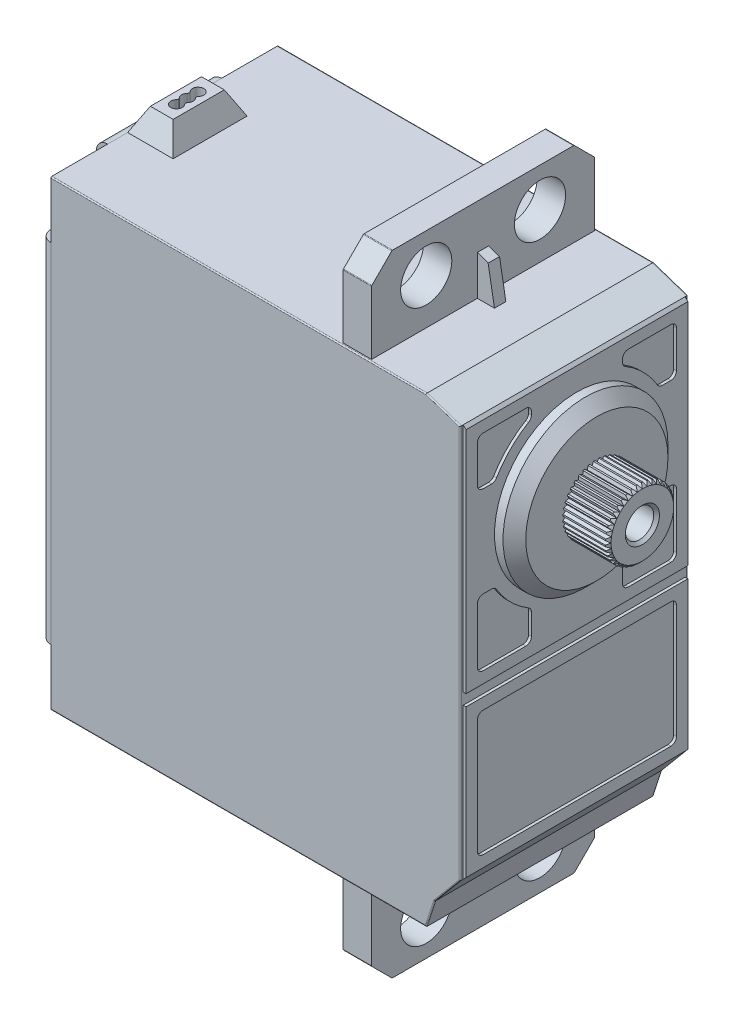
from build123d import *

# Parameters (mm, degrees)
BOSS_EXTRUDE1_DEPTH = 20
CUT_EXTRUDE1_REACH  = 65.246
SKETCH2_W           = 6.75
SKETCH2_H           = 2
CUT_EXTRUDE2_REACH  = 61.54
SKETCH3_R           = 2.25
SKETCH4_R           = 7.25
BOSS_EXTRUDE2_DEPTH = 2
SKETCH5_R           = 3
BOSS_EXTRUDE3_DEPTH = 4
SKETCH7_W           = 1
SKETCH7_H           = 3.5
BOSS_EXTRUDE4_DEPTH = 1.5
CUT_EXTRUDE4_REACH  = 69.476
CHAMFER1_SIZE       = 1
CHAMFER2_SIZE       = 2
CUT_EXTRUDE5_REACH  = 67.792
CUT_EXTRUDE6_REACH  = 68.843
CUT_EXTRUDE7_REACH  = 67.294
SKETCH12_R          = 1.25
CUT_EXTRUDE8_DEPTH  = 20
CHAMFER3_SIZE       = 0.25
SKETCH13_W          = 19.5
SKETCH13_H          = 13
SKETCH13_W_2        = 17.5
SKETCH13_H_2        = 11
SKETCH13_H_3        = 20.1
SKETCH13_R          = 7.25
BOSS_EXTRUDE5_DEPTH = 0.25
CHAMFER4_SIZE       = 0.25
SKETCH15_R          = 0.5
CUT_EXTRUDE10_DEPTH = 4
FILLET1_R           = 0.2
CUT_EXTRUDE11_START = -4
CUT_EXTRUDE11_DEPTH = 4
CIRPATTERN1_COUNT   = 40
SKETCH17_W          = 5
SKETCH17_H          = 5
CUT_EXTRUDE12_DEPTH = 1
FILLET2_R           = 2.5
SKETCH18_R          = 2
BOSS_EXTRUDE9_DEPTH = 1
CUT_EXTRUDE14_DEPTH = 0.9
FILLET3_R           = 0.25
FILLET4_R           = 0.4
FILLET5_SIZE        = 0.6
FILLET5_SIZE_2      = 0.4
FILLET7_R           = 0.2
SKETCH24_W          = 0.2
SKETCH24_H          = 7.4
CUT_EXTRUDE15_DEPTH = 2.5
FILLET8_R           = 0.1
FILLET9_R           = 0.5
FILLET10_R          = 1


with BuildPart() as part:
    # Sketch1 → Boss-Extrude1 (new body)
    with BuildSketch(Plane.XY):
        Polygon((5, 40.6), (26.5, 40.6), (26.5, 48), (29, 48), (29, 40.6), (37, 40.6), (37, 0), (29, 0), (29, -7.4), (26.5, -7.4), (26.5, 0), (0, 0), (0, 40.6), (1, 40.6), (1, 42.6), (5, 42.6), align=None)
    extrude(amount=BOSS_EXTRUDE1_DEPTH)

    # Sketch2 → Cut-Extrude1 (cut, up to next)
    with BuildSketch(Plane.ZY.offset(-1), mode=Mode.PRIVATE) as cut_extrude1_sk1:
        with Locations((16.625, 41.6)):
            Rectangle(SKETCH2_W, SKETCH2_H)
    cut_extrude1_tool1 = extrude(cut_extrude1_sk1.sketch, amount=-CUT_EXTRUDE1_REACH, mode=Mode.PRIVATE) & part.part
    # Sketch2 → Cut-Extrude1 (cut, up to next)
    with BuildSketch(Plane.ZY.offset(-1), mode=Mode.PRIVATE) as cut_extrude1_sk2:
        with Locations((3.375, 41.6)):
            Rectangle(SKETCH2_W, SKETCH2_H)
    cut_extrude1_tool2 = extrude(cut_extrude1_sk2.sketch, amount=-CUT_EXTRUDE1_REACH, mode=Mode.PRIVATE) & part.part
    add(cut_extrude1_tool1.solids().sort_by_distance((1, 41.6, 16.625))[0], mode=Mode.SUBTRACT)
    add(cut_extrude1_tool2.solids().sort_by_distance((1, 41.6, 3.375))[0], mode=Mode.SUBTRACT)

    # Sketch3 → Cut-Extrude2 (cut, up to next)
    with BuildSketch(Plane(origin=(29, 0, 0), x_dir=(0, 0, -1), z_dir=(1, 0, 0)), mode=Mode.PRIVATE) as cut_extrude2_sk1:
        with Locations((-15, -4)):
            Circle(SKETCH3_R)
    cut_extrude2_tool1 = extrude(cut_extrude2_sk1.sketch, amount=-CUT_EXTRUDE2_REACH, mode=Mode.PRIVATE) & part.part
    # Sketch3 → Cut-Extrude2 (cut, up to next)
    with BuildSketch(Plane(origin=(29, 0, 0), x_dir=(0, 0, -1), z_dir=(1, 0, 0)), mode=Mode.PRIVATE) as cut_extrude2_sk2:
        with Locations((-5, -4)):
            Circle(SKETCH3_R)
    cut_extrude2_tool2 = extrude(cut_extrude2_sk2.sketch, amount=-CUT_EXTRUDE2_REACH, mode=Mode.PRIVATE) & part.part
    # Sketch3 → Cut-Extrude2 (cut, up to next)
    with BuildSketch(Plane(origin=(29, 0, 0), x_dir=(0, 0, -1), z_dir=(1, 0, 0)), mode=Mode.PRIVATE) as cut_extrude2_sk3:
        with Locations((-15, 44.6)):
            Circle(SKETCH3_R)
    cut_extrude2_tool3 = extrude(cut_extrude2_sk3.sketch, amount=-CUT_EXTRUDE2_REACH, mode=Mode.PRIVATE) & part.part
    # Sketch3 → Cut-Extrude2 (cut, up to next)
    with BuildSketch(Plane(origin=(29, 0, 0), x_dir=(0, 0, -1), z_dir=(1, 0, 0)), mode=Mode.PRIVATE) as cut_extrude2_sk4:
        with Locations((-5, 44.6)):
            Circle(SKETCH3_R)
    cut_extrude2_tool4 = extrude(cut_extrude2_sk4.sketch, amount=-CUT_EXTRUDE2_REACH, mode=Mode.PRIVATE) & part.part
    add(cut_extrude2_tool1.solids().sort_by_distance((29, -4, 15))[0], mode=Mode.SUBTRACT)
    add(cut_extrude2_tool2.solids().sort_by_distance((29, -4, 5))[0], mode=Mode.SUBTRACT)
    add(cut_extrude2_tool3.solids().sort_by_distance((29, 44.6, 15))[0], mode=Mode.SUBTRACT)
    add(cut_extrude2_tool4.solids().sort_by_distance((29, 44.6, 5))[0], mode=Mode.SUBTRACT)

    # Sketch4 → Boss-Extrude2 (add)
    with BuildSketch(Plane(origin=(37, 0, 0), x_dir=(0, 0, -1), z_dir=(1, 0, 0))):
        with Locations((-10, 30.1)):
            Circle(SKETCH4_R)
    extrude(amount=BOSS_EXTRUDE2_DEPTH)

    # Sketch5 → Boss-Extrude3 (add)
    with BuildSketch(Plane(origin=(39, 0, 0), x_dir=(0, 0, -1), z_dir=(1, 0, 0))):
        with Locations((-10, 30.1)):
            Circle(SKETCH5_R)
    extrude(amount=BOSS_EXTRUDE3_DEPTH)

    # Sketch7 → Boss-Extrude4 (add)
    with BuildSketch(Plane(origin=(29, 0, 0), x_dir=(0, 0, -1), z_dir=(1, 0, 0))):
        with Locations((-10, 42.35)):
            Rectangle(SKETCH7_W, SKETCH7_H)
        with Locations((-10, -1.75)):
            Rectangle(SKETCH7_W, SKETCH7_H)
    extrude(amount=BOSS_EXTRUDE4_DEPTH)

    # Sketch8 → Cut-Extrude4 (cut, up to next)
    with BuildSketch(Plane.XY.offset(20), mode=Mode.PRIVATE) as cut_extrude4_sk1:
        Polygon((37, 0), (34, 0), (34.75, 2.318554417), (37, 5), align=None)
    cut_extrude4_tool1 = extrude(cut_extrude4_sk1.sketch, amount=-CUT_EXTRUDE4_REACH, mode=Mode.PRIVATE) & part.part
    # Sketch8 → Cut-Extrude4 (cut, up to next)
    with BuildSketch(Plane.XY.offset(20), mode=Mode.PRIVATE) as cut_extrude4_sk2:
        Polygon((37, 39.6), (34, 40.6), (37, 40.6), align=None)
    cut_extrude4_tool2 = extrude(cut_extrude4_sk2.sketch, amount=-CUT_EXTRUDE4_REACH, mode=Mode.PRIVATE) & part.part
    add(cut_extrude4_tool1.solids().sort_by_distance((35.86794, 1.802751, 20))[0], mode=Mode.SUBTRACT)
    add(cut_extrude4_tool2.solids().sort_by_distance((36, 40.266667, 20))[0], mode=Mode.SUBTRACT)

    # Chamfer1
    chamfer1_edges = [part.edges().sort_by_distance(p)[0] for p in [
        (39, 30.1, 17.25),
    ]]
    chamfer(chamfer1_edges, length=CHAMFER1_SIZE)

    # Chamfer2
    chamfer2_edges = [part.edges().sort_by_distance(p)[0] for p in [
        (27.75, -7.4, 20),
        (27.75, 48, 0),
        (27.75, -7.4, 0),
        (27.75, 48, 20),
    ]]
    chamfer(chamfer2_edges, length=CHAMFER2_SIZE)

    # Sketch9 → Cut-Extrude5 (cut, up to next)
    with BuildSketch(Plane(origin=(0, 0, 6.75), x_dir=(-1, 0, 0), z_dir=(0, 0, -1)), mode=Mode.PRIVATE) as cut_extrude5_sk1:
        Polygon((-5, 42.6), (-4, 42.6), (-5, 40.6), align=None)
    cut_extrude5_tool1 = extrude(cut_extrude5_sk1.sketch, amount=-CUT_EXTRUDE5_REACH, mode=Mode.PRIVATE) & part.part
    # Sketch9 → Cut-Extrude5 (cut, up to next)
    with BuildSketch(Plane(origin=(0, 0, 6.75), x_dir=(-1, 0, 0), z_dir=(0, 0, -1)), mode=Mode.PRIVATE) as cut_extrude5_sk2:
        Polygon((-1, 42.6), (-2, 42.6), (-1, 40.6), align=None)
    cut_extrude5_tool2 = extrude(cut_extrude5_sk2.sketch, amount=-CUT_EXTRUDE5_REACH, mode=Mode.PRIVATE) & part.part
    add(cut_extrude5_tool1.solids().sort_by_distance((4.666667, 41.933333, 6.75))[0], mode=Mode.SUBTRACT)
    add(cut_extrude5_tool2.solids().sort_by_distance((1.333333, 41.933333, 6.75))[0], mode=Mode.SUBTRACT)

    # Sketch10 → Cut-Extrude6 (cut, up to next)
    with BuildSketch(Plane.ZY.offset(-1), mode=Mode.PRIVATE) as cut_extrude6_sk1:
        Polygon((12.25, 42.6), (13.25, 40.6), (13.25, 42.6), align=None)
    cut_extrude6_tool1 = extrude(cut_extrude6_sk1.sketch, amount=-CUT_EXTRUDE6_REACH, mode=Mode.PRIVATE) & part.part
    # Sketch10 → Cut-Extrude6 (cut, up to next)
    with BuildSketch(Plane.ZY.offset(-1), mode=Mode.PRIVATE) as cut_extrude6_sk2:
        Polygon((6.75, 40.6), (7.75, 42.6), (6.75, 42.6), align=None)
    cut_extrude6_tool2 = extrude(cut_extrude6_sk2.sketch, amount=-CUT_EXTRUDE6_REACH, mode=Mode.PRIVATE) & part.part
    add(cut_extrude6_tool1.solids().sort_by_distance((1, 41.933333, 12.916667))[0], mode=Mode.SUBTRACT)
    add(cut_extrude6_tool2.solids().sort_by_distance((1, 41.933333, 7.083333))[0], mode=Mode.SUBTRACT)

    # Sketch11 → Cut-Extrude7 (cut, up to next)
    with BuildSketch(Plane(origin=(0, 0, 9.5), x_dir=(-1, 0, 0), z_dir=(0, 0, -1)), mode=Mode.PRIVATE) as cut_extrude7_sk1:
        Polygon((-29, -3.5), (-29.943400938, -3.156630139), (-30.5, 0), (-30.5, -3.5), align=None)
    cut_extrude7_tool1 = extrude(cut_extrude7_sk1.sketch, amount=-CUT_EXTRUDE7_REACH, mode=Mode.PRIVATE) & part.part
    # Sketch11 → Cut-Extrude7 (cut, up to next)
    with BuildSketch(Plane(origin=(0, 0, 9.5), x_dir=(-1, 0, 0), z_dir=(0, 0, -1)), mode=Mode.PRIVATE) as cut_extrude7_sk2:
        Polygon((-29, 44.1), (-29.943400938, 43.756630139), (-30.5, 40.6), (-30.5, 44.1), align=None)
    cut_extrude7_tool2 = extrude(cut_extrude7_sk2.sketch, amount=-CUT_EXTRUDE7_REACH, mode=Mode.PRIVATE) & part.part
    add(cut_extrude7_tool1.solids().sort_by_distance((30.209915, -2.462831, 9.5))[0], mode=Mode.SUBTRACT)
    add(cut_extrude7_tool2.solids().sort_by_distance((30.209915, 43.062831, 9.5))[0], mode=Mode.SUBTRACT)

    # Sketch12 → Cut-Extrude8 (cut)
    with BuildSketch(Plane(origin=(43, 0, 0), x_dir=(0, 0, -1), z_dir=(1, 0, 0))):
        with Locations((-10, 30.1)):
            Circle(SKETCH12_R)
    extrude(amount=-CUT_EXTRUDE8_DEPTH, mode=Mode.SUBTRACT)

    # Chamfer3
    chamfer3_edges = [part.edges().sort_by_distance(p)[0] for p in [
        (43, 30.1, 11.25),
        (43, 30.1, 13),
    ]]
    chamfer(chamfer3_edges, length=CHAMFER3_SIZE)

    # Sketch13 → Boss-Extrude5 (add)
    # profile 1 of 2: a face of its own
    with BuildSketch(Plane(origin=(37, 0, 0), x_dir=(0, 0, -1), z_dir=(1, 0, 0))):
        with Locations((-10, 11.75)):
            Rectangle(SKETCH13_W, SKETCH13_H)
        with Locations((-10, 11.75)):
            Rectangle(SKETCH13_W_2, SKETCH13_H_2, mode=Mode.SUBTRACT)
    # profile 2 of 2: a face of its own
    with BuildSketch(Plane(origin=(37, 0, 0), x_dir=(0, 0, -1), z_dir=(1, 0, 0))):
        with Locations((-10, 29.3)):
            Rectangle(SKETCH13_W, SKETCH13_H_3)
        with Locations((-10, 30.1)):
            Circle(SKETCH13_R, mode=Mode.SUBTRACT)
        with BuildLine():
            ThreePointArc((-14, 22.884565155), (-15.833630945, 24.266369055), (-17.215434845, 26.1))
            Line((-17.215434845, 26.1), (-18.75, 26.1))
            Line((-18.75, 26.1), (-18.75, 20.25))
            Line((-18.75, 20.25), (-14, 20.25))
            Line((-14, 20.25), (-14, 22.884565155))
        make_face(mode=Mode.SUBTRACT)
        with BuildLine():
            ThreePointArc((-2.784565155, 26.1), (-4.166369055, 24.266369055), (-6, 22.884565155))
            Line((-6, 22.884565155), (-6, 20.25))
            Line((-6, 20.25), (-1.25, 20.25))
            Line((-1.25, 20.25), (-1.25, 26.1))
            Line((-1.25, 26.1), (-2.784565155, 26.1))
        make_face(mode=Mode.SUBTRACT)
        with BuildLine():
            ThreePointArc((-6, 37.315434845), (-4.166369055, 35.933630945), (-2.784565155, 34.1))
            Line((-2.784565155, 34.1), (-1.25, 34.1))
            Line((-1.25, 34.1), (-1.25, 38.35))
            Line((-1.25, 38.35), (-6, 38.35))
            Line((-6, 38.35), (-6, 37.315434845))
        make_face(mode=Mode.SUBTRACT)
        with BuildLine():
            ThreePointArc((-17.215434845, 34.1), (-15.833630945, 35.933630945), (-14, 37.315434845))
            Line((-14, 37.315434845), (-14, 38.35))
            Line((-14, 38.35), (-18.75, 38.35))
            Line((-18.75, 38.35), (-18.75, 34.1))
            Line((-18.75, 34.1), (-17.215434845, 34.1))
        make_face(mode=Mode.SUBTRACT)
    extrude(amount=BOSS_EXTRUDE5_DEPTH)

    # Chamfer4
    chamfer4_edges = [part.edges().sort_by_distance(p)[0] for p in [
        (37, 5.25, 10),
        (37, 39.35, 10),
    ]]
    chamfer(chamfer4_edges, length=CHAMFER4_SIZE - 0.0001)  # a hair under: the kernel refuses the full size

    # Sketch15 → Cut-Extrude10 (cut)
    with BuildSketch(Plane(origin=(0, 42.6, 0), x_dir=(1, 0, 0), z_dir=(0, 1, 0))):
        with Locations((3, -10)):
            Circle(SKETCH15_R)
        with Locations((3, -9.05)):
            Circle(SKETCH15_R)
        with Locations((3, -10.95)):
            Circle(SKETCH15_R)
    extrude(amount=-CUT_EXTRUDE10_DEPTH, mode=Mode.SUBTRACT)

    # Fillet1
    fillet1_edges = [part.edges().sort_by_distance(p)[0] for p in [
        (2.84387505, 40.6, 9.525),
        (3.15612495, 40.6, 10.475),
        (2.84387505, 40.6, 10.475),
        (3.15612495, 40.6, 9.525),
    ]]
    fillet(fillet1_edges, radius=FILLET1_R)

    # Sketch16 → Cut-Extrude11 (cut)
    with BuildSketch(Plane(origin=(43, 0, 0), x_dir=(0, 0, -1), z_dir=(1, 0, 0)).offset(CUT_EXTRUDE11_START)):
        with BuildLine():
            Line((-12.75, 30.1), (-12.995087524, 30.271612132))
            ThreePointArc((-12.995087524, 30.271612132), (-13, 30.1), (-12.995087524, 29.928387868))
            Line((-12.995087524, 29.928387868), (-12.75, 30.1))
        make_face()
    cut_extrude11 = extrude(amount=CUT_EXTRUDE11_DEPTH, mode=Mode.SUBTRACT)

    # CirPattern1: Cut-Extrude11 ×40 about axis
    cirpattern1_axis = Axis((0, 30.1, 10), (1, 0, 0))
    for i in range(1, CIRPATTERN1_COUNT):
        add(cut_extrude11.rotate(cirpattern1_axis, i * 360 / CIRPATTERN1_COUNT), mode=Mode.SUBTRACT)

    # Sketch17 → Cut-Extrude12 (cut)
    with BuildSketch(Plane.ZY):
        with Locations((17.5, 2.5)):
            Rectangle(SKETCH17_W, SKETCH17_H)
        with Locations((2.5, 38.1)):
            Rectangle(SKETCH17_W, SKETCH17_H)
        with Locations((2.5, 2.5)):
            Rectangle(SKETCH17_W, SKETCH17_H)
        with Locations((17.5, 38.1)):
            Rectangle(SKETCH17_W, SKETCH17_H)
    extrude(amount=-CUT_EXTRUDE12_DEPTH, mode=Mode.SUBTRACT)

    # Fillet2
    fillet2_edges = [part.edges().sort_by_distance(p)[0] for p in [
        (0.5, 5, 5),
        (0.5, 35.6, 15),
        (0.5, 35.6, 5),
        (0.5, 5, 15),
    ]]
    fillet(fillet2_edges, radius=FILLET2_R)

    # Sketch24 → Cut-Extrude15 (cut)
    with BuildSketch(Plane(origin=(29, 0, 0), x_dir=(0, 0, -1), z_dir=(1, 0, 0))):
        with Locations((-19.9, 44.3)):
            Rectangle(SKETCH24_W, SKETCH24_H)
        with Locations((-0.1, 44.3)):
            Rectangle(SKETCH24_W, SKETCH24_H)
        with Locations((-19.9, -3.7)):
            Rectangle(SKETCH24_W, SKETCH24_H)
        with Locations((-0.1, -3.7)):
            Rectangle(SKETCH24_W, SKETCH24_H)
    extrude(amount=-CUT_EXTRUDE15_DEPTH, mode=Mode.SUBTRACT)

    # Fillet8
    fillet8_edges = [part.edges().sort_by_distance(p)[0] for p in [
        (27.75, 46.2, 0.2),
        (27.75, -5.6, 19.8),
        (27.75, -5.6, 0.2),
        (27.75, 46.2, 19.8),
        (37, 22.3, 0),
        (37, 22.3, 20),
        (34.375, 1.159277208, 0),
        (35.875, 3.659277208, 0),
        (35.875, 3.659277208, 20),
        (34.375, 1.159277208, 20),
        (35.5, 40.1, 0),
        (35.5, 40.1, 20),
        (17.5, 40.6, 0),
        (27.75, -7.4, 18),
        (27.75, -7.4, 2),
        (27.75, 48, 18),
        (27.75, 48, 2),
        (17.5, 0, 0),
        (17.5, 0, 20),
        (17.5, 40.6, 20),
    ]]
    fillet(fillet8_edges, radius=FILLET8_R)

    # Fillet9
    fillet9_edges = [part.edges().sort_by_distance(p)[0] for p in [
        (37.125, 6.25, 18.75),
        (37.125, 17.25, 18.75),
        (37.125, 17.25, 1.25),
        (37.125, 6.25, 1.25),
        (37.125, 37.315434845, 14),
        (37.125, 34.1, 17.215434845),
        (37.125, 34.1, 18.75),
        (37.125, 38.35, 18.75),
        (37.125, 34.1, 2.784565155),
        (37.125, 37.315434845, 6),
        (37.125, 38.35, 6),
        (37.125, 38.35, 1.25),
        (37.125, 22.884565155, 6),
        (37.125, 26.1, 2.784565155),
        (37.125, 26.1, 1.25),
        (37.125, 20.25, 1.25),
        (37.125, 26.1, 17.215434845),
        (37.125, 22.884565155, 14),
        (37.125, 20.25, 14),
        (37.125, 20.25, 18.75),
        (37.125, 38.35, 14),
        (37.125, 34.1, 1.25),
        (37.125, 20.25, 6),
        (37.125, 26.1, 18.75),
    ]]
    fillet(fillet9_edges, radius=FILLET9_R)

    # Fillet10
    fillet10_edges = [part.edges().sort_by_distance(p)[0] for p in [
        (0, 0, 10),
        (0, 20.3, 0),
        (0, 40.6, 10),
        (0, 20.3, 20),
    ]]
    fillet(fillet10_edges, radius=FILLET10_R - 0.0001)  # a hair under: the kernel refuses the full size


with BuildPart() as body_2:
    # Sketch18 → Boss-Extrude9 (new body)
    with BuildSketch(Plane.ZY.offset(-1)):
        with Locations((17.146446609, 2.853553391)):
            Circle(SKETCH18_R)
    extrude(amount=BOSS_EXTRUDE9_DEPTH)

    # Sketch19 → Cut-Extrude14 (cut)
    with BuildSketch(Plane.ZY):
        Polygon((17.646446609, 1.353553391), (16.646446609, 1.353553391), (16.646446609, 2.353553391), (15.646446609, 2.353553391), (15.646446609, 3.353553391), (16.646446609, 3.353553391), (16.646446609, 4.353553391), (17.646446609, 4.353553391), (17.646446609, 3.353553391), (18.646446609, 3.353553391), (18.646446609, 2.353553391), (17.646446609, 2.353553391), align=None)
    extrude(amount=-CUT_EXTRUDE14_DEPTH, mode=Mode.SUBTRACT)

    # Fillet3
    fillet3_edges = [body_2.edges().sort_by_distance(p)[0] for p in [
        (0.45, 1.353553391, 17.646446609),
        (0.45, 1.353553391, 16.646446609),
        (0.45, 2.353553391, 15.646446609),
        (0.45, 3.353553391, 15.646446609),
        (0.45, 4.353553391, 16.646446609),
        (0.45, 4.353553391, 17.646446609),
        (0.45, 3.353553391, 18.646446609),
        (0.45, 2.353553391, 18.646446609),
    ]]
    fillet(fillet3_edges, radius=FILLET3_R)

    # Fillet4
    fillet4_edges = [body_2.edges().sort_by_distance(p)[0] for p in [
        (0.45, 2.353553391, 17.646446609),
        (0.45, 2.353553391, 16.646446609),
        (0.45, 3.353553391, 16.646446609),
        (0.45, 3.353553391, 17.646446609),
    ]]
    fillet(fillet4_edges, radius=FILLET4_R)

    # Fillet5
    # a fillet whose section is not a circle: 0.6, 0.4 mm, written as the material it takes off along each edge
    with BuildSketch(Plane(origin=(0, 2.853553391, 17.146446609), x_dir=(0, 0, 1), z_dir=(0, -1, 0))) as fillet5_piece_1:
        with BuildLine():
            Bezier((2 - FILLET5_SIZE, 0), (2, 0), (2, -FILLET5_SIZE_2), weights=[1, 0.707106781, 1])
            Line((2, -FILLET5_SIZE_2), (2, 0))
            Line((2, 0), (2 - FILLET5_SIZE, 0))
        make_face()
    revolve(axis=Axis((0, 2.853553391, 17.146446609), (-1, 0, 0)), mode=Mode.SUBTRACT)

    # Fillet7
    fillet7_edges = [body_2.edges().sort_by_distance(p)[0] for p in [
        (0.9, 3.280330086, 15.719669914),
        (0.9, 3.353553391, 16.071446609),
        (0.9, 3.470710678, 16.529289322),
        (0.9, 3.928553391, 16.646446609),
        (0.9, 4.280330086, 16.719669914),
        (0.9, 4.353553391, 17.146446609),
        (0.9, 4.280330086, 17.573223305),
        (0.9, 3.928553391, 17.646446609),
        (0.9, 3.470710678, 17.763603897),
        (0.9, 3.353553391, 18.221446609),
        (0.9, 3.280330086, 18.573223305),
        (0.9, 2.853553391, 18.646446609),
        (0.9, 2.426776695, 18.573223305),
        (0.9, 2.353553391, 18.221446609),
        (0.9, 2.236396103, 17.763603897),
        (0.9, 1.778553391, 17.646446609),
        (0.9, 1.426776695, 17.573223305),
        (0.9, 1.353553391, 17.146446609),
        (0.9, 1.426776695, 16.719669914),
        (0.9, 1.778553391, 16.646446609),
        (0.9, 2.236396103, 16.529289322),
        (0.9, 2.353553391, 16.071446609),
        (0.9, 2.426776695, 15.719669914),
        (0.9, 2.853553391, 15.646446609),
    ]]
    fillet(fillet7_edges, radius=FILLET7_R)


with BuildPart() as body_3:
    # Sketch-Pattern9: read off the stored shape, not the designer's step
    # Sketch-Pattern9: copy of body 2
    add(body_2.part.moved(Location((0, 34.8928932, 0))))


with BuildPart() as body_4:
    # Sketch-Pattern9 2: copy of body 2
    add(body_2.part.moved(Location((0, 0, -14.2928932))))


with BuildPart() as body_5:
    # Sketch-Pattern9 3: copy of body 2
    add(body_2.part.moved(Location((0, 34.8928932, -14.2928932))))


solid = Compound([part.part, body_2.part, body_3.part, body_4.part, body_5.part])
